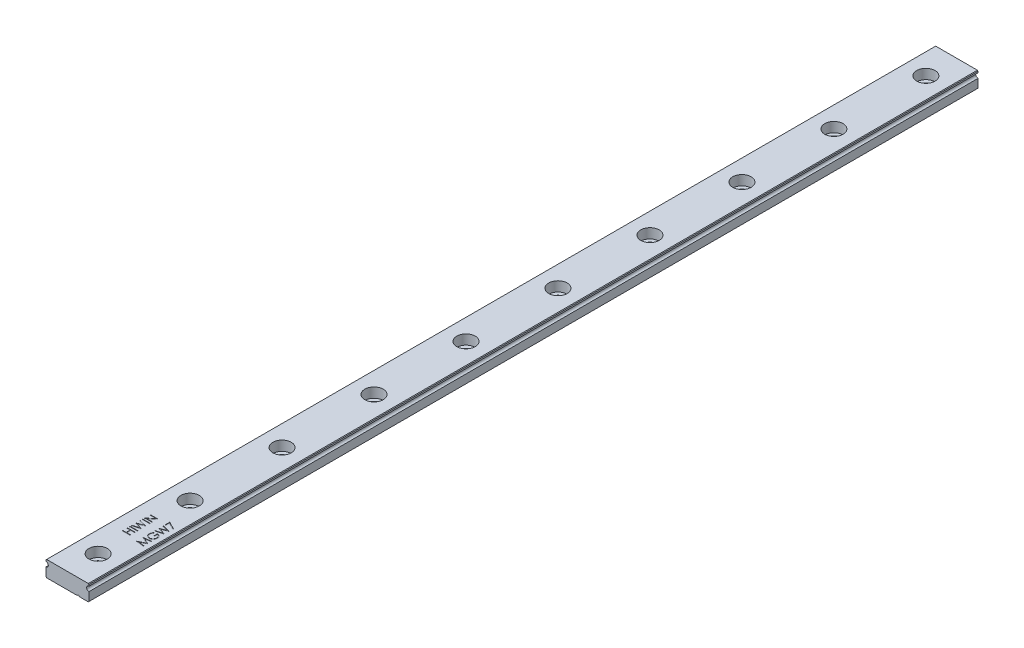
from build123d import *

# Parameters (mm, degrees)
EXTRUDE_1_DEPTH              = 290
HOLE_WIZARD_M3_1_D           = 3.5
HOLE_WIZARD_M3_1_CBORE_D     = 6
HOLE_WIZARD_M3_1_CBORE_DEPTH = 3.2
PATTERN_LINEAR_1_COUNT       = 10
PATTERN_LINEAR_1_PITCH       = 30
SKETCH_4_W                   = 2.5
SKETCH_4_H                   = 0.224358975
SKETCH_4_H_2                 = 0.224358974
CUT_EXTRUDE_1_DEPTH          = 0.1


with BuildPart() as part:
    # 草图1 → 凸台-拉伸1 (new body)
    with BuildSketch(Plane.XY):
        with BuildLine():
            Line((6.8, 5.2), (-6.8, 5.2))
            Line((-6.8, 5.2), (-7, 5))
            Line((-7, 5), (-7, 4.5))
            ThreePointArc((-7, 4.5), (-6.25, 3.75), (-7, 3))
            Line((-7, 3), (-7, 0.2))
            Line((-7, 0.2), (-6.8, 0))
            Line((-6.8, 0), (3.2, 0))
            ThreePointArc((3.2, 0), (3.5, 0.3), (3.8, 0))
            Line((3.8, 0), (6.8, 0))
            Line((6.8, 0), (7, 0.2))
            Line((7, 0.2), (7, 3))
            ThreePointArc((7, 3), (6.25, 3.75), (7, 4.5))
            Line((7, 4.5), (7, 5))
            Line((7, 5), (6.8, 5.2))
        make_face()
    extrude(amount=-EXTRUDE_1_DEPTH)

    # M3 六角凹头螺钉的柱形沉头孔1 (through all)
    with Locations(Plane(origin=(-1.59728338, 5.2, -94.560513739), x_dir=(-1, 0, 0), z_dir=(0, 1, 0))):
        with Locations((-1.59728338, 84.560513739)):
            hole_wizard_m3_1 = CounterBoreHole(HOLE_WIZARD_M3_1_D / 2, HOLE_WIZARD_M3_1_CBORE_D / 2, HOLE_WIZARD_M3_1_CBORE_DEPTH)

    # 阵列(线性)1: M3 六角凹头螺钉的柱形沉头孔1 ×10
    with Locations(*[(0, 0, -i * PATTERN_LINEAR_1_PITCH) for i in range(1, PATTERN_LINEAR_1_COUNT)]):
        add(hole_wizard_m3_1, mode=Mode.SUBTRACT)

    # 草图4 → 切除-拉伸1 (cut)
    with BuildSketch(Plane(origin=(0, 5.2, 0), x_dir=(1, 0, 0), z_dir=(0, 1, 0))):
        Polygon((-2.5, 20.384615385), (-2.5, 20.608974359), (-1.474358974, 20.608974359), (-1.474358974, 21.891025641), (-2.5, 21.891025641), (-2.5, 22.115384615), (0, 22.115384615), (0, 21.891025641), (-1.217948718, 21.891025641), (-1.217948718, 20.608974359), (0, 20.608974359), (0, 20.384615385), align=None)
        with Locations((-1.25, 22.868589744)):
            Rectangle(SKETCH_4_W, SKETCH_4_H)
        Polygon((-2.5, 23.365384615), (-2.5, 23.597255609), (-0.666566506, 24.086538462), (-2.5, 24.814202724), (-2.5, 24.846754808), (-0.679086538, 25.560897436), (-2.5, 26.052684295), (-2.5, 26.282051282), (0, 25.607972756), (0, 25.575921474), (-1.912059295, 24.823717949), (0, 24.0625), (0, 24.030448718), align=None)
        with Locations((-1.25, 26.971153846)):
            Rectangle(SKETCH_4_W, SKETCH_4_H_2)
        Polygon((0, 27.628205128), (-2.5, 27.628205128), (-2.5, 27.675280449), (-0.532351763, 29.326923077), (-2.5, 29.326923077), (-2.5, 29.551282051), (0, 29.551282051), (0, 29.500200321), (-1.963141026, 27.852564103), (0, 27.852564103), align=None)
        Polygon((5.262820513, 19.471153846), (2.762820513, 19.801181891), (2.762820513, 19.833233173), (4.814102564, 20.865384615), (2.762820513, 21.895032051), (2.762820513, 21.927584135), (5.262820513, 22.259615385), (5.262820513, 22.034254808), (3.463942308, 21.794871795), (5.262820513, 20.892427885), (5.262820513, 20.841846955), (3.459935897, 19.935897436), (5.262820513, 19.697015224), align=None)
        with BuildLine():
            Line((3.189503205, 25.112179487), (3.371794872, 24.919871795))
            add(Edge.make_bspline(
                [(3.371794872, 24.919871795), (3.33904757, 24.885079595), (3.274333845, 24.816324834), (3.190503317, 24.704039161), (3.117979797, 24.587356408), (3.059411518, 24.466087909), (3.013467474, 24.343413623), (2.980070357, 24.221442942), (2.958920243, 24.100965586), (2.956379944, 24.020848227), (2.955128205, 23.981370192)],
                knots=[0, 0, 0, 0, 1.089067066, 2.152164705, 3.18986567, 4.218445106, 5.218487318, 6.173592265, 7.100032889, 8, 8, 8, 8], degree=3))
            add(Edge.make_bspline(
                [(2.955128205, 23.981370192), (2.955423638, 23.957145407), (2.956013737, 23.908758663), (2.96354532, 23.836885846), (2.974377365, 23.76576682), (2.990050135, 23.695535838), (3.009913749, 23.626056347), (3.03476051, 23.557569998), (3.063728533, 23.489949019), (3.097201762, 23.423830434), (3.133972959, 23.35972991), (3.17472236, 23.299189913), (3.218141306, 23.241821011), (3.265326503, 23.188714435), (3.315815291, 23.139516925), (3.36869841, 23.093323568), (3.425015604, 23.050995297), (3.484535284, 23.013291269), (3.54587275, 22.979242987), (3.608507802, 22.949819987), (3.671858982, 22.924241449), (3.736403314, 22.904760048), (3.801475372, 22.888259423), (3.867416166, 22.876772826), (3.934397892, 22.870275457), (3.979253391, 22.869153678), (4.001802885, 22.868589744)],
                knots=[0, 0, 0, 0, 1.028150113, 2.053633673, 3.06513288, 4.081487945, 5.106702018, 6.131327874, 7.172780699, 8.228344599, 9.276313556, 10.308389736, 11.324843658, 12.329040066, 13.321460474, 14.316307835, 15.308626991, 16.309440696, 17.305625405, 18.28535951, 19.246194545, 20.203493668, 21.145557131, 22.095268976, 23.042464743, 24, 24, 24, 24], degree=3))
            add(Edge.make_bspline(
                [(4.001802885, 22.868589744), (4.024853357, 22.869129883), (4.070891358, 22.870208687), (4.139603074, 22.877103828), (4.207286347, 22.889928978), (4.274047635, 22.906937371), (4.340019803, 22.92856071), (4.405134006, 22.955126791), (4.469383912, 22.986774029), (4.53213171, 23.023324935), (4.593203233, 23.063688841), (4.651212146, 23.108082544), (4.705483374, 23.156580784), (4.756809618, 23.208294315), (4.80486696, 23.263694312), (4.84907614, 23.323318263), (4.890120768, 23.386331544), (4.927549936, 23.452762107), (4.96098377, 23.521907807), (4.990715349, 23.592805258), (5.01520053, 23.665682331), (5.035156334, 23.740155664), (5.051513685, 23.816136577), (5.062036887, 23.89401072), (5.069673194, 23.973205512), (5.07023153, 24.02659025), (5.070512821, 24.053485577)],
                knots=[0, 0, 0, 0, 0.935915162, 1.869274651, 2.799799983, 3.730201895, 4.664668062, 5.616159355, 6.583070886, 7.570012957, 8.562524459, 9.553461134, 10.53281078, 11.515274572, 12.509912756, 13.507571325, 14.526460018, 15.561318395, 16.601025881, 17.643204557, 18.680545676, 19.719612342, 20.772381578, 21.833430283, 22.908478249, 24, 24, 24, 24], degree=3))
            add(Edge.make_bspline(
                [(5.070512821, 24.053485577), (5.069835547, 24.085898814), (5.06850561, 24.149547471), (5.058144274, 24.243107343), (5.041982509, 24.332973499), (5.01824033, 24.418853383), (4.988188581, 24.501058665), (4.95102531, 24.579286156), (4.907141535, 24.653751866), (4.857425896, 24.724133481), (4.802034135, 24.788757782), (4.742795058, 24.847573552), (4.678941178, 24.898558282), (4.611424143, 24.943234937), (4.539598137, 24.98016154), (4.463862736, 25.010480024), (4.384171075, 25.033717493), (4.329105703, 25.043256842), (4.301282051, 25.048076923)],
                knots=[0, 0, 0, 0, 1.130199668, 2.219330667, 3.279027493, 4.311506524, 5.322739849, 6.327972234, 7.327472899, 8.33386792, 9.329086447, 10.29244429, 11.240784345, 12.174119183, 13.111530729, 14.052100829, 15.015757696, 16, 16, 16, 16], degree=3))
            Line((4.301282051, 25.048076923), (4.301282051, 24.21474359))
            Line((4.301282051, 24.21474359), (4.044871795, 24.21474359))
            Line((4.044871795, 24.21474359), (4.044871795, 25.272435897))
            add(Edge.make_bspline(
                [(4.044871795, 25.272435897), (4.092662858, 25.271217434), (4.186198602, 25.268832682), (4.322605939, 25.252104885), (4.451442863, 25.22509309), (4.572845057, 25.188192868), (4.68664048, 25.14042481), (4.79294467, 25.082301576), (4.891070871, 25.012892918), (4.981820159, 24.934671174), (5.062769596, 24.84688549), (5.133916695, 24.751907904), (5.193847134, 24.649581498), (5.24260475, 24.540003064), (5.280657604, 24.423531326), (5.307637301, 24.299896769), (5.323801561, 24.169267054), (5.325866832, 24.079740857), (5.326923077, 24.033954327)],
                knots=[0, 0, 0, 0, 1.140356446, 2.231883559, 3.274166699, 4.278491846, 5.25512956, 6.21435461, 7.1637429, 8.11826594, 9.068280886, 10.0076534, 10.945064095, 11.891975133, 12.864533718, 13.863980011, 14.907571808, 16, 16, 16, 16], degree=3))
            add(Edge.make_bspline(
                [(5.326923077, 24.033954327), (5.326516562, 24.005732802), (5.325714783, 23.950070858), (5.320016678, 23.867863052), (5.311244837, 23.787921895), (5.297998321, 23.710259031), (5.281773568, 23.634588787), (5.26099734, 23.561289083), (5.236948269, 23.490080696), (5.209594216, 23.420853564), (5.177900176, 23.35423603), (5.142679005, 23.289931375), (5.104112319, 23.227584143), (5.061533143, 23.167619025), (5.015259957, 23.109723581), (4.965200015, 23.054271121), (4.911506358, 23.000951208), (4.873378494, 22.967550877), (4.854166667, 22.950721154)],
                knots=[0, 0, 0, 0, 1.107784379, 2.184907829, 3.233506516, 4.263428166, 5.276301166, 6.270063455, 7.25232949, 8.225834625, 9.190232166, 10.146266622, 11.1027726, 12.066435141, 13.031522626, 14.010570082, 14.99756817, 16, 16, 16, 16], degree=3))
            add(Edge.make_bspline(
                [(4.854166667, 22.950721154), (4.823687629, 22.926302631), (4.763235474, 22.877870908), (4.666378371, 22.815529367), (4.566091328, 22.762385508), (4.462095164, 22.719265635), (4.354487155, 22.685595573), (4.243404804, 22.66144825), (4.128705068, 22.647300186), (4.051087022, 22.645261945), (4.01181891, 22.644230769)],
                knots=[0, 0, 0, 0, 1.023165419, 2.029347347, 3.013907458, 3.994755782, 4.975994455, 5.96558838, 6.970761222, 8, 8, 8, 8], degree=3))
            add(Edge.make_bspline(
                [(4.01181891, 22.644230769), (3.982414444, 22.644610939), (3.923979224, 22.645366448), (3.837224006, 22.654527532), (3.752009222, 22.667671398), (3.668404553, 22.686990737), (3.586354076, 22.711345156), (3.50582002, 22.741740714), (3.426753625, 22.777129126), (3.349703777, 22.818264639), (3.275675481, 22.864028022), (3.205031003, 22.913747777), (3.138915276, 22.967807552), (3.077175141, 23.026364762), (3.018895531, 23.088238998), (2.965293816, 23.154729213), (2.915531219, 23.224828024), (2.870563926, 23.299078839), (2.830158316, 23.376310004), (2.79473826, 23.456353636), (2.765464245, 23.539180649), (2.74062589, 23.624171762), (2.722257916, 23.711969961), (2.708937388, 23.801938206), (2.699822673, 23.894545427), (2.699089633, 23.957142591), (2.698717949, 23.988882212)],
                knots=[0, 0, 0, 0, 1.00895651, 2.005089799, 2.991467152, 3.967318338, 4.948153826, 5.927364234, 6.919980553, 7.91976625, 8.923240147, 9.905815003, 10.88314567, 11.851989312, 12.825009789, 13.798721852, 14.781296708, 15.773896486, 16.776076962, 17.771600213, 18.775744723, 19.78957137, 20.808953803, 21.851964491, 22.910847925, 24, 24, 24, 24], degree=3))
            add(Edge.make_bspline(
                [(2.698717949, 23.988882212), (2.699131871, 24.014766671), (2.699952631, 24.066092513), (2.705641666, 24.142468036), (2.714658724, 24.217663047), (2.726963571, 24.29178904), (2.74372335, 24.364593587), (2.763779268, 24.436284091), (2.78713057, 24.506964474), (2.814979746, 24.576413223), (2.846589478, 24.645097306), (2.882170494, 24.713398621), (2.922331211, 24.781083796), (2.96719088, 24.848270212), (3.015979035, 24.915381539), (3.070091052, 24.981356283), (3.12739302, 25.047786958), (3.16859458, 25.090502539), (3.189503205, 25.112179487)],
                knots=[0, 0, 0, 0, 0.985871117, 1.954866573, 2.915460327, 3.869826059, 4.81536089, 5.759505086, 6.70452669, 7.649098992, 8.607881297, 9.583363685, 10.581137262, 11.603961102, 12.659522466, 13.73993555, 14.853081303, 16, 16, 16, 16], degree=3))
        make_face()
        Polygon((2.762820513, 25.625), (2.762820513, 25.856870994), (4.596254006, 26.346153846), (2.762820513, 27.073818109), (2.762820513, 27.106370192), (4.583733974, 27.820512821), (2.762820513, 28.312299679), (2.762820513, 28.541666667), (5.262820513, 27.867588141), (5.262820513, 27.835536859), (3.350761218, 27.083333333), (5.262820513, 26.322115385), (5.262820513, 26.290064103), align=None)
        Polygon((2.762820513, 29.054487179), (2.762820513, 30.592948718), (5.326923077, 29.278846154), (5.220252404, 29.085036058), (3.019230769, 30.213341346), (3.019230769, 29.054487179), align=None)
    extrude(amount=-CUT_EXTRUDE_1_DEPTH, mode=Mode.SUBTRACT)


solid = part.part
